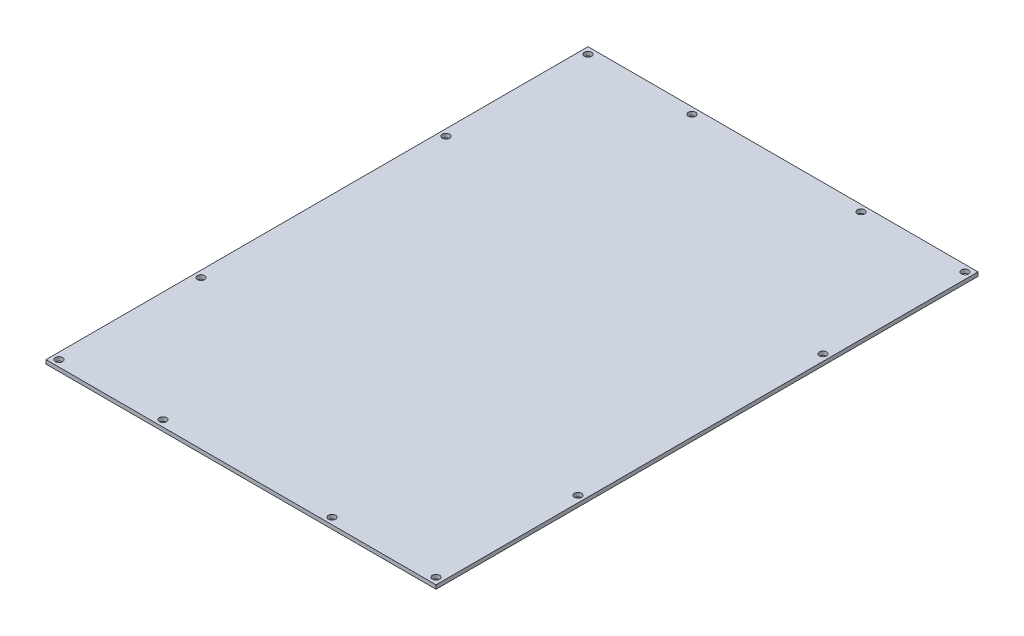
from build123d import *

# Parameters (mm, degrees)
SKETCH1_W                    = 300
SKETCH1_H                    = 416.9
BOSS_EXTRUDE1_DEPTH          = 3
M5_CLEARANCE_HOLE1_OUTLINE_R = 2.75
M5_CLEARANCE_HOLE1_DEPTH     = 3


# Read off the part's stored shape, not the designer's step: M5 Clearance Hole1
with BuildPart() as part:
    # Sketch1 → Boss-Extrude1 (new body)
    with BuildSketch(Plane(origin=(0, 0, 0), x_dir=(1, 0, 0), z_dir=(0, 1, 0))):
        Rectangle(SKETCH1_W, SKETCH1_H)
    extrude(amount=BOSS_EXTRUDE1_DEPTH)

    # M5 Clearance Hole1 outline → M5 Clearance Hole1 (cut)
    with BuildSketch(Plane(origin=(0, 0, 0), x_dir=(1, 0, 0), z_dir=(0, 1, 0))):
        with Locations((65, -203.45)):
            Circle(M5_CLEARANCE_HOLE1_OUTLINE_R)
        with Locations((-65, -203.45)):
            Circle(M5_CLEARANCE_HOLE1_OUTLINE_R)
        with Locations((145, -94.22)):
            Circle(M5_CLEARANCE_HOLE1_OUTLINE_R)
        with Locations((145, 94.22)):
            Circle(M5_CLEARANCE_HOLE1_OUTLINE_R)
        with Locations((-145, -94.22)):
            Circle(M5_CLEARANCE_HOLE1_OUTLINE_R)
        with Locations((-145, 94.22)):
            Circle(M5_CLEARANCE_HOLE1_OUTLINE_R)
        with Locations((65, 203.45)):
            Circle(M5_CLEARANCE_HOLE1_OUTLINE_R)
        with Locations((-65, 203.45)):
            Circle(M5_CLEARANCE_HOLE1_OUTLINE_R)
        with Locations((145, 203.45)):
            Circle(M5_CLEARANCE_HOLE1_OUTLINE_R)
        with Locations((-145, -203.45)):
            Circle(M5_CLEARANCE_HOLE1_OUTLINE_R)
        with Locations((145, -203.45)):
            Circle(M5_CLEARANCE_HOLE1_OUTLINE_R)
        with Locations((-145, 203.45)):
            Circle(M5_CLEARANCE_HOLE1_OUTLINE_R)
    extrude(amount=M5_CLEARANCE_HOLE1_DEPTH, mode=Mode.SUBTRACT)


solid = part.part
